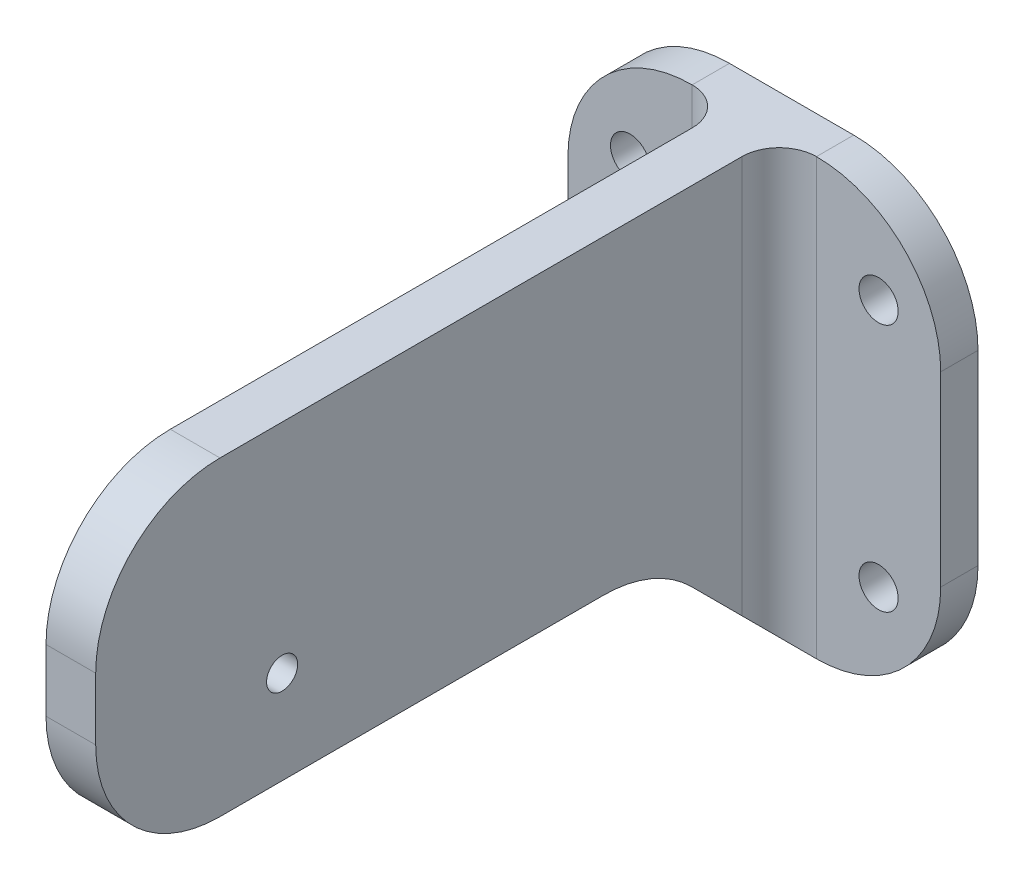
from build123d import *

# Parameters (mm, degrees)
SKETCH1_W           = 30
SKETCH1_H           = 35
BOSS_EXTRUDE1_DEPTH = 3
SKETCH2_W           = 4
SKETCH2_H           = 35
BOSS_EXTRUDE2_DEPTH = 55
FILLET1_R           = 10
FILLET2_R           = 10
SKETCH3_R           = 1.575
CUT_EXTRUDE1_DEPTH  = 55
SKETCH4_R           = 1.25
CUT_EXTRUDE2_DEPTH  = 55
SKETCH5_W           = 53.614570856
SKETCH5_H           = 10
CUT_EXTRUDE3_DEPTH  = 55
FILLET3_R           = 10
CUT_EXTRUDE4_DEPTH  = 55
FILLET4_R           = 10
FILLET5_R           = 3


with BuildPart() as part:
    # Sketch1 → Boss-Extrude1 (new body)
    with BuildSketch(Plane.XY):
        Rectangle(SKETCH1_W, SKETCH1_H)
    extrude(amount=BOSS_EXTRUDE1_DEPTH)

    # Sketch2 → Boss-Extrude2 (add)
    with BuildSketch(Plane.XY.offset(3)):
        Rectangle(SKETCH2_W, SKETCH2_H)
    extrude(amount=BOSS_EXTRUDE2_DEPTH)

    # Fillet1
    fillet1_edges = [part.edges().sort_by_distance(p)[0] for p in [
        (0, 17.5, 58),
        (0, -17.5, 58),
    ]]
    fillet(fillet1_edges, radius=FILLET1_R)

    # Fillet2
    fillet2_edges = [part.edges().sort_by_distance(p)[0] for p in [
        (15, -17.5, 1.5),
        (-15, -17.5, 1.5),
        (-15, 17.5, 1.5),
        (15, 17.5, 1.5),
    ]]
    fillet(fillet2_edges, radius=FILLET2_R)

    # Sketch3 → Cut-Extrude1 (cut)
    with BuildSketch(Plane.XY.offset(3)):
        with Locations((-10, 10)):
            Circle(SKETCH3_R)
        with Locations((10, -10)):
            Circle(SKETCH3_R)
        with Locations((10, 10)):
            Circle(SKETCH3_R)
        with Locations((-10, -10)):
            Circle(SKETCH3_R)
    extrude(amount=-CUT_EXTRUDE1_DEPTH, mode=Mode.SUBTRACT)

    # Sketch4 → Cut-Extrude2 (cut)
    with BuildSketch(Plane(origin=(2, 0, 0), x_dir=(0, 0, -1), z_dir=(1, 0, 0))):
        with Locations((-43, 0)):
            Circle(SKETCH4_R)
    extrude(amount=-CUT_EXTRUDE2_DEPTH, mode=Mode.SUBTRACT)

    # Sketch5 → Cut-Extrude3 (cut)
    with BuildSketch(Plane(origin=(2, 0, 0), x_dir=(0, 0, -1), z_dir=(1, 0, 0))):
        with Locations((-39.807285428, -12.5)):
            Rectangle(SKETCH5_W, SKETCH5_H)
    extrude(amount=-CUT_EXTRUDE3_DEPTH, mode=Mode.SUBTRACT)

    # Fillet3
    fillet3_edges = [part.edges().sort_by_distance(p)[0] for p in [
        (0, -7.5, 58),
    ]]
    fillet(fillet3_edges, radius=FILLET3_R)

    # Sketch6 → Cut-Extrude4 (cut)
    with BuildSketch(Plane(origin=(2, 0, 0), x_dir=(0, 0, -1), z_dir=(1, 0, 0))):
        Polygon((-13, -7.5), (-3, -17.5), (-13, -17.5), align=None)
    extrude(amount=-CUT_EXTRUDE4_DEPTH, mode=Mode.SUBTRACT)

    # Fillet4
    fillet4_edges = [part.edges().sort_by_distance(p)[0] for p in [
        (0, -7.5, 13),
    ]]
    fillet(fillet4_edges, radius=FILLET4_R)

    # Fillet5
    fillet5_edges = [part.edges().sort_by_distance(p)[0] for p in [
        (2, 0, 3),
        (-2, 0, 3),
    ]]
    fillet(fillet5_edges, radius=FILLET5_R - 0.0001)  # a hair under: the kernel refuses the full size


solid = part.part
